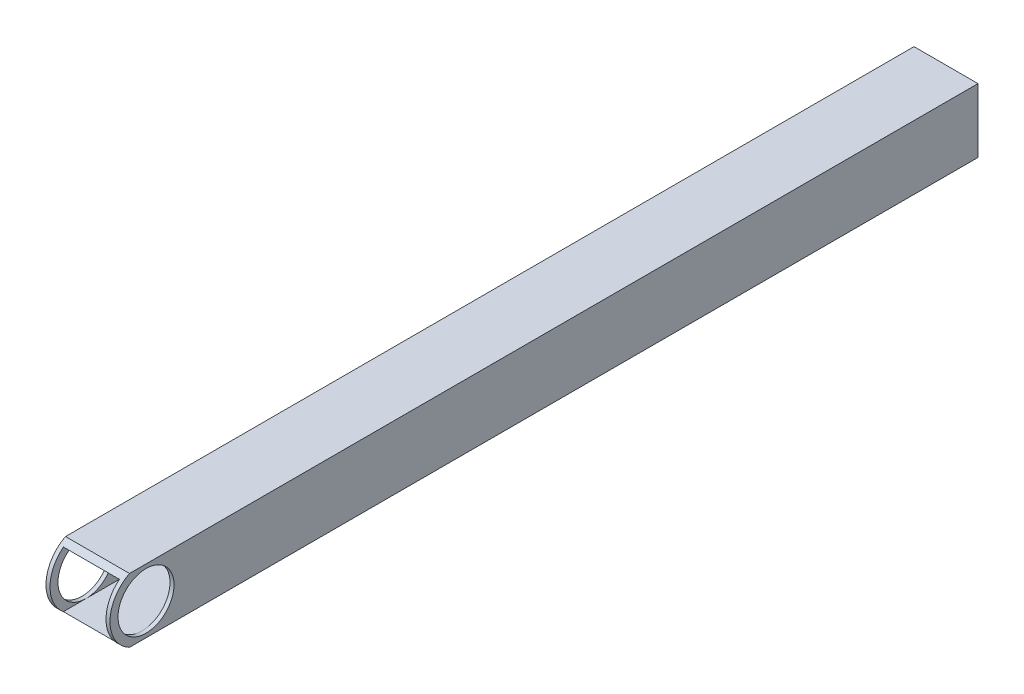
from build123d import *

# Parameters (mm, degrees)
SKETCH1_W                        = 25.4
SKETCH1_H                        = 25.4
SKETCH1_W_2                      = 22.225
SKETCH1_H_2                      = 22.225
EXTRUDE_THIN1_DEPTH              = 174.625
SKETCH2_R                        = 11.1125
CUT_EXTRUDE1_DEPTH               = 177.91902279
CUT_EXTRUDE2_DEPTH               = 177.91902279
F_1_8_0_135_DIAMETER_HOLE2_D     = 3.429
F_1_8_0_135_DIAMETER_HOLE2_DEPTH = 16.51
F_1_8_0_135_DIAMETER_HOLE2_TIP   = 1.030175531


with BuildPart() as part:
    # Sketch1 → Extrude-Thin1 (new, symmetric)
    with BuildSketch(Plane.XY):
        Rectangle(SKETCH1_W, SKETCH1_H)
        Rectangle(SKETCH1_W_2, SKETCH1_H_2, mode=Mode.SUBTRACT)
    extrude(amount=EXTRUDE_THIN1_DEPTH, both=True)

    # Sketch2 → Cut-Extrude1 (cut, through all)
    with BuildSketch(Plane(origin=(12.7, 0, 0), x_dir=(0, 0, -1), z_dir=(1, 0, 0))):
        with Locations((-155.575, 0)):
            Circle(SKETCH2_R)
    extrude(amount=-CUT_EXTRUDE1_DEPTH, mode=Mode.SUBTRACT)

    # Sketch3 → Cut-Extrude2 (cut, through all)
    with BuildSketch(Plane(origin=(12.7, 0, 0), x_dir=(0, 0, -1), z_dir=(1, 0, 0))):
        with BuildLine():
            Line((-155.575, 14.2875), (-174.625, 14.2875))
            Line((-174.625, 14.2875), (-174.625, -12.7))
            Line((-174.625, -12.7), (-162.120430181, -12.7))
            ThreePointArc((-162.120430181, -12.7), (-169.4599542, 3.367596045), (-155.575, 14.2875))
        make_face()
    extrude(amount=-CUT_EXTRUDE2_DEPTH, mode=Mode.SUBTRACT)

    # 1/8 (0.135) Diameter Hole2
    with Locations(Plane.ZY.offset(12.7)):
        with Locations((131.7625, -6.35), (106.3625, 6.35), (87.047916667, -6.35), (61.647916667, 6.35), (42.333333333, -6.35), (16.933333333, 6.35), (-2.38125, -6.35), (-27.78125, 6.35), (-47.095833333, -6.35), (-72.495833333, 6.35), (-91.810416667, -6.35), (-117.210416667, 6.35), (-136.525, -6.35), (-161.925, 6.35)):
            Hole(F_1_8_0_135_DIAMETER_HOLE2_D / 2, depth=F_1_8_0_135_DIAMETER_HOLE2_DEPTH)
            with Locations((0, 0, -(F_1_8_0_135_DIAMETER_HOLE2_DEPTH + F_1_8_0_135_DIAMETER_HOLE2_TIP / 2))):  # 118° drill point
                Cone(0, F_1_8_0_135_DIAMETER_HOLE2_D / 2, F_1_8_0_135_DIAMETER_HOLE2_TIP, mode=Mode.SUBTRACT)


solid = part.part
